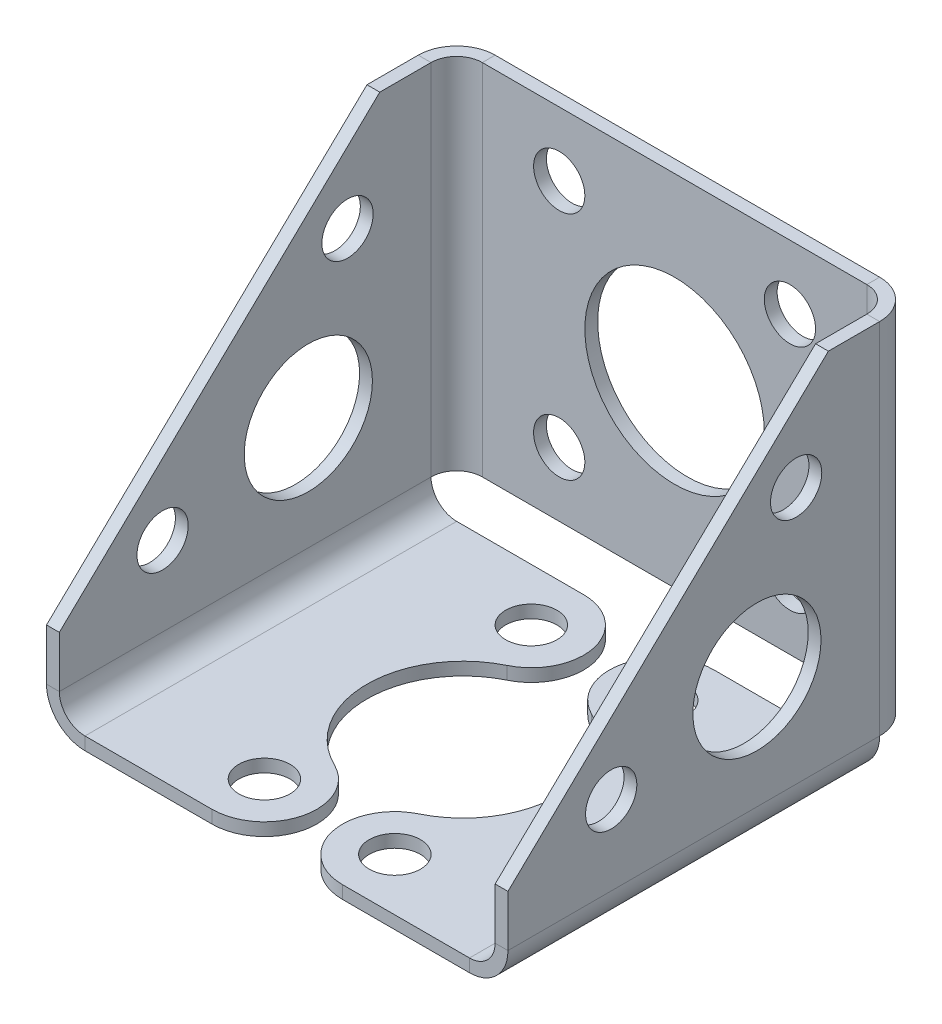
from build123d import *

# Parameters (mm, degrees)
SKETCH1_W                      = 180
SKETCH1_H                      = 140
BASE_FLANGE1_DEPTH             = 5
EDGE_FLANGE1_STRIP_W           = 40
EDGE_FLANGE1_STRIP_H           = 5
EDGE_FLANGE1_STRIP_CUT_DEPTH   = 140
EDGE_FLANGE1_STRIP_2_W         = 40
EDGE_FLANGE1_STRIP_2_H         = 5
EDGE_FLANGE1_STRIP_CUT_2_DEPTH = 140
EDGE_FLANGE1_DEPTH             = 140
EDGE_FLANGE1_BEND_DEPTH        = 140
EDGE_FLANGE2_DEPTH             = 145
EDGE_FLANGE2_BEND_DEPTH        = 145
CUT_EXTRUDE1_DEPTH             = 256.391855782
CUT_EXTRUDE3_DEPTH             = 10
UNFOLD2_START                  = -85
UNFOLD2_DEPTH                  = 155
UNFOLD2_START_2                = -127.134954085
UNFOLD2_2_OUTLINE_W            = 145
UNFOLD2_2_OUTLINE_H            = 5
UNFOLD2_2_DEPTH                = 77.134954085
UNFOLD2_START_3                = -70
UNFOLD2_3_DEPTH                = 140
UNFOLD2_4_DEPTH                = 5
SKETCH24_R                     = 10
SKETCH24_R_2                   = 25
SKETCH24_R_3                   = 35
CUT_EXTRUDE4_DEPTH             = 10
FOLD1_START                    = -161
FOLD1_DEPTH                    = 231
FOLD1_START_2                  = -85
FOLD1_2_OUTLINE_R              = 10
FOLD1_2_DEPTH                  = 15
FOLD1_START_3                  = -70
FOLD1_3_DEPTH                  = 140
FOLD1_START_4                  = -75
FOLD1_4_OUTLINE_W              = 10
FOLD1_4_OUTLINE_H              = 145
FOLD1_4_DEPTH                  = 150
FOLD1_START_5                  = -90
FOLD1_5_OUTLINE_R              = 25
FOLD1_5_OUTLINE_R_2            = 10
FOLD1_5_DEPTH                  = 180
FOLD1_6_OUTLINE_W              = 5
FOLD1_6_OUTLINE_H              = 145
FOLD1_6_DEPTH                  = 2.982774194
FOLD1_START_6                  = 87.176322581
FOLD1_7_OUTLINE_W              = 5
FOLD1_7_OUTLINE_H              = 145
FOLD1_7_DEPTH                  = 2.823677419
FOLD1_START_7                  = 15
FOLD1_8_DEPTH                  = 145


with BuildPart() as part:
    # Base-Flange1: sheet metal written as solids
    # Sketch1 → Base-Flange1 (new body)
    with BuildSketch(Plane.XY):
        Rectangle(SKETCH1_W, SKETCH1_H)
    extrude(amount=BASE_FLANGE1_DEPTH)

    # Edge-Flange1: sheet metal written as solids
    # Edge-Flange1 strip (on a plane across the edge) → Edge-Flange1 strip cut (cut)
    with BuildSketch(Plane(origin=(-90, 70, 5), x_dir=(1, 0, 0), z_dir=(0, -1, 0))):
        with Locations((-5, -2.5)):
            Rectangle(EDGE_FLANGE1_STRIP_W, EDGE_FLANGE1_STRIP_H)
    extrude(amount=EDGE_FLANGE1_STRIP_CUT_DEPTH, mode=Mode.SUBTRACT)

    # Edge-Flange1 strip 2 (on a plane across the edge) → Edge-Flange1 strip cut 2 (cut)
    with BuildSketch(Plane(origin=(90, -70, 5), x_dir=(-1, 0, 0), z_dir=(0, 1, 0))):
        with Locations((-5, -2.5)):
            Rectangle(EDGE_FLANGE1_STRIP_2_W, EDGE_FLANGE1_STRIP_2_H)
    extrude(amount=EDGE_FLANGE1_STRIP_CUT_2_DEPTH, mode=Mode.SUBTRACT)

    # Edge-Flange1 section (on a plane across the edge) → Edge-Flange1 (add)
    with BuildSketch(Plane(origin=(-90, 70, 5), x_dir=(1, 0, 0), z_dir=(0, -1, 0))):
        with BuildLine():
            Line((0, 10), (0, 155))
            Line((0, 155), (5, 155))
            Line((5, 155), (5, 10))
            ThreePointArc((5, 10), (7.928932188, 2.928932188), (15, 0))
            Line((15, 0), (15, -5))
            ThreePointArc((15, -5), (4.393398282, -0.606601718), (0, 10))
        make_face()
    extrude(amount=EDGE_FLANGE1_DEPTH)

    # Edge-Flange1 section 2 (on a plane across the edge) → Edge-Flange1 bend (add)
    with BuildSketch(Plane(origin=(90, -70, 5), x_dir=(-1, 0, 0), z_dir=(0, 1, 0))):
        with BuildLine():
            Line((0, 10), (0, 155))
            Line((0, 155), (5, 155))
            Line((5, 155), (5, 10))
            ThreePointArc((5, 10), (7.928932188, 2.928932188), (15, 0))
            Line((15, 0), (15, -5))
            ThreePointArc((15, -5), (4.393398282, -0.606601718), (0, 10))
        make_face()
    extrude(amount=EDGE_FLANGE1_BEND_DEPTH)

    # Edge-Flange2: sheet metal written as solids
    # Edge-Flange2 section (on a plane across the edge) → Edge-Flange2 (add)
    with BuildSketch(Plane(origin=(-85, -80, 160), x_dir=(0, 1, 0), z_dir=(0, 0, -1))):
        with BuildLine():
            Line((-5, 10), (-5, 80))
            Line((-5, 80), (0, 80))
            Line((0, 80), (0, 10))
            ThreePointArc((0, 10), (2.928932188, 2.928932188), (10, 0))
            Line((10, 0), (10, -5))
            ThreePointArc((10, -5), (-0.606601718, -0.606601718), (-5, 10))
        make_face()
    extrude(amount=EDGE_FLANGE2_DEPTH)

    # Edge-Flange2 section 2 (on a plane across the edge) → Edge-Flange2 bend (add)
    with BuildSketch(Plane(origin=(85, -80, 15), x_dir=(0, 1, 0), z_dir=(0, 0, 1))):
        with BuildLine():
            Line((-5, 10), (-5, 80))
            Line((-5, 80), (0, 80))
            Line((0, 80), (0, 10))
            ThreePointArc((0, 10), (2.928932188, 2.928932188), (10, 0))
            Line((10, 0), (10, -5))
            ThreePointArc((10, -5), (-0.606601718, -0.606601718), (-5, 10))
        make_face()
    extrude(amount=EDGE_FLANGE2_BEND_DEPTH)

    # Sketch18 → Cut-Extrude1 (cut, through all)
    with BuildSketch(Plane(origin=(90, 0, 0), x_dir=(0, 0, -1), z_dir=(1, 0, 0))):
        Polygon((-35, 70), (-160, 70), (-160, -50), align=None)
    extrude(amount=-CUT_EXTRUDE1_DEPTH, mode=Mode.SUBTRACT)

    # Sketch19 → Cut-Extrude3 (cut)
    with BuildSketch(Plane(origin=(0, -80, 0), x_dir=(1, 0, 0), z_dir=(0, 1, 0))):
        with BuildLine():
            ThreePointArc((-25.442327374, -15), (-10.987419064, -20.987419064), (-5, -35.442327374))
            Line((-5, -35.442327374), (-5, -15))
            Line((-5, -15), (-25.442327374, -15))
        make_face()
        with BuildLine():
            Line((25.442327374, -15), (5, -15))
            Line((5, -15), (5, -35.442327365))
            ThreePointArc((5, -35.442327365), (10.987419068, -20.987419061), (25.442327374, -15))
        make_face()
        with BuildLine():
            ThreePointArc((-16.466153842, -121.191479303), (-8.101874289, -128.731896198), (-5, -139.557672626))
            Line((-5, -139.557672626), (-5, -35.442327374))
            ThreePointArc((-5, -35.442327374), (-8.101874289, -46.268103802), (-16.466153842, -53.808520697))
            ThreePointArc((-16.466153842, -53.808520697), (-37.5, -87.5), (-16.466153842, -121.191479303))
        make_face()
        with BuildLine():
            ThreePointArc((16.466153842, -53.808520697), (8.101874287, -46.268103798), (5, -35.442327365))
            Line((5, -35.442327365), (5, -139.557672626))
            ThreePointArc((5, -139.557672626), (8.101874289, -128.731896198), (16.466153842, -121.191479303))
            ThreePointArc((16.466153842, -121.191479303), (37.5, -87.5), (16.466153842, -53.808520697))
        make_face()
        with BuildLine():
            Line((-25.442327374, -160), (-5, -160))
            Line((-5, -160), (-5, -139.557672626))
            ThreePointArc((-5, -139.557672626), (-10.987419064, -154.012580936), (-25.442327374, -160))
        make_face()
        with BuildLine():
            ThreePointArc((25.442327374, -160), (10.987419064, -154.012580936), (5, -139.557672626))
            Line((5, -139.557672626), (5, -160))
            Line((5, -160), (25.442327374, -160))
        make_face()
    extrude(amount=-CUT_EXTRUDE3_DEPTH, mode=Mode.SUBTRACT)

    # Unfold2: read off the stored shape, not the designer's step
    # Unfold2 outline → Unfold2 (cut)
    with BuildSketch(Plane(origin=(0, 0, 0), x_dir=(1, 0, 0), z_dir=(0, 1, 0)).offset(UNFOLD2_START)):
        with BuildLine():
            Line((86.180339888, -5), (75, -5))
            ThreePointArc((75, -5), (82.071067812, -7.928932188), (85, -15))
            Line((85, -15), (25.442327374, -15))
            ThreePointArc((25.442327374, -15), (5.525795485, -30.835755333), (16.466153842, -53.808520697))
            ThreePointArc((16.466153842, -53.808520697), (37.5, -87.5), (16.466153842, -121.191479303))
            ThreePointArc((16.466153842, -121.191479303), (5.525795485, -144.164244667), (25.442327374, -160))
            Line((25.442327374, -160), (90, -160))
            Line((90, -160), (90, -15))
            ThreePointArc((90, -15), (89.012585385, -9.647668653), (86.180339888, -5))
        make_face()
        with BuildLine():
            Line((-75, -5), (-86.180339888, -5))
            ThreePointArc((-86.180339888, -5), (-89.012585385, -9.647668653), (-90, -15))
            Line((-90, -15), (-90, -160))
            Line((-90, -160), (-25.442327374, -160))
            ThreePointArc((-25.442327374, -160), (-5.525795485, -144.164244667), (-16.466153842, -121.191479303))
            ThreePointArc((-16.466153842, -121.191479303), (-37.5, -87.5), (-16.466153842, -53.808520697))
            ThreePointArc((-16.466153842, -53.808520697), (-5.525795485, -30.835755333), (-25.442327374, -15))
            Line((-25.442327374, -15), (-85, -15))
            ThreePointArc((-85, -15), (-82.071067812, -7.928932188), (-75, -5))
        make_face()
    extrude(amount=UNFOLD2_DEPTH, mode=Mode.SUBTRACT)



with BuildPart() as body_2:
    # Unfold2 2 outline → Unfold2 2 (new body)
    with BuildSketch(Plane(origin=(0, 0, 0), x_dir=(1, 0, 0), z_dir=(0, 1, 0)).offset(UNFOLD2_START_2)):
        with Locations((167.134954085, -2.5)):
            Rectangle(UNFOLD2_2_OUTLINE_W, UNFOLD2_2_OUTLINE_H)
        with Locations((-167.134954085, -2.5)):
            Rectangle(UNFOLD2_2_OUTLINE_W, UNFOLD2_2_OUTLINE_H)
    extrude(amount=UNFOLD2_2_DEPTH)


with BuildPart() as part_1:
    add(part.part)

    add(body_2.part)  # Unfold2 3 merges body 2
    # Unfold2 3 outline → Unfold2 3 (add)
    with BuildSketch(Plane(origin=(0, 0, 0), x_dir=(1, 0, 0), z_dir=(0, 1, 0)).offset(UNFOLD2_START_3)):
        with BuildLine():
            ThreePointArc((75, 0), (81.123724357, -1.306936062), (86.180339888, -5))
            Line((86.180339888, -5), (94.634954085, -5))
            Line((94.634954085, -5), (94.634954085, 0))
            Line((94.634954085, 0), (75, 0))
        make_face()
        with BuildLine():
            Line((-94.634954085, 0), (-94.634954085, -5))
            Line((-94.634954085, -5), (-86.180339888, -5))
            ThreePointArc((-86.180339888, -5), (-81.123724357, -1.306936062), (-75, 0))
            Line((-75, 0), (-94.634954085, 0))
        make_face()
    extrude(amount=UNFOLD2_3_DEPTH)

    # Unfold2 4 outline → Unfold2 4 (add)
    with BuildSketch(Plane.XY):
        Polygon((114.634954085, 70), (94.634954085, 70), (94.634954085, -50), (239.634954085, -50), align=None)
        Polygon((-94.634954085, 70), (-114.634954085, 70), (-239.634954085, -50), (-94.634954085, -50), align=None)
        with BuildLine():
            ThreePointArc((133.443474782, -148.168800243), (147.275834791, -132.825122573), (167.134953866, -127.134954085))
            Line((167.134953866, -127.134954085), (94.634954085, -127.134954085))
            Line((94.634954085, -127.134954085), (94.634954085, -139.192626711))
            ThreePointArc((94.634954085, -139.192626711), (110.470709418, -159.1091586), (133.443474782, -148.168800243))
        make_face()
        with BuildLine():
            ThreePointArc((167.134953866, -127.134954085), (186.994073194, -132.825122457), (200.826433388, -148.168800243))
            ThreePointArc((200.826433388, -148.168800243), (223.799198752, -159.1091586), (239.634954085, -139.192626711))
            Line((239.634954085, -139.192626711), (239.634954085, -127.134954085))
            Line((239.634954085, -127.134954085), (167.134953866, -127.134954085))
        make_face()
        with BuildLine():
            ThreePointArc((-200.826433388, -148.168800243), (-186.994073379, -132.825122573), (-167.134954304, -127.134954085))
            Line((-167.134954304, -127.134954085), (-239.634954085, -127.134954085))
            Line((-239.634954085, -127.134954085), (-239.634954085, -139.192626711))
            ThreePointArc((-239.634954085, -139.192626711), (-223.799198752, -159.1091586), (-200.826433388, -148.168800243))
        make_face()
        with BuildLine():
            ThreePointArc((-167.134954304, -127.134954085), (-147.275834976, -132.825122457), (-133.443474782, -148.168800243))
            ThreePointArc((-133.443474782, -148.168800243), (-110.470709418, -159.1091586), (-94.634954085, -139.192626711))
            Line((-94.634954085, -139.192626711), (-94.634954085, -127.134954085))
            Line((-94.634954085, -127.134954085), (-167.134954304, -127.134954085))
        make_face()
    extrude(amount=UNFOLD2_4_DEPTH)

    # Sketch24 → Cut-Extrude4 (cut)
    with BuildSketch(Plane.XY.offset(5)):
        with Locations((-219.192626711, -139.192626711)):
            Circle(SKETCH24_R)
        with Locations((-115.077281458, -139.192626711)):
            Circle(SKETCH24_R)
        with Locations((115.077281458, -139.192626711)):
            Circle(SKETCH24_R)
        with Locations((-45, -45)):
            Circle(SKETCH24_R)
        with Locations((45, -45)):
            Circle(SKETCH24_R)
        with Locations((219.192626711, -139.192626711)):
            Circle(SKETCH24_R)
        with Locations((-45, 45)):
            Circle(SKETCH24_R)
        with Locations((45, 45)):
            Circle(SKETCH24_R)
        with Locations((-199.353683573, -39.05433783)):
            Circle(SKETCH24_R)
        with Locations((-127.21495147, 30.198844989)):
            Circle(SKETCH24_R)
        with Locations((-142.508362675, -26.069366052)):
            Circle(SKETCH24_R_2)
        Circle(SKETCH24_R_3)
        with Locations(Location((142.508362675, -26.069366052, 0), (0, 0, 180))):
            Circle(SKETCH24_R_2)
        with Locations(Location((199.353683573, -39.05433783, 0), (0, 0, 180))):
            Circle(SKETCH24_R)
        with Locations(Location((127.21495147, 30.198844989, 0), (0, 0, 180))):
            Circle(SKETCH24_R)
    extrude(amount=-CUT_EXTRUDE4_DEPTH, mode=Mode.SUBTRACT)

    # Fold1: read off the stored shape, not the designer's step
    # Fold1 outline → Fold1 (cut)
    with BuildSketch(Plane(origin=(0, 0, 0), x_dir=(1, 0, 0), z_dir=(0, 1, 0)).offset(FOLD1_START)):
        with BuildLine():
            ThreePointArc((75, 0), (81.123724357, -1.306936062), (86.180339888, -5))
            Line((86.180339888, -5), (239.634954085, -5))
            Line((239.634954085, -5), (239.634954085, 0))
            Line((239.634954085, 0), (75, 0))
        make_face()
        with BuildLine():
            ThreePointArc((-86.180339888, -5), (-81.123724357, -1.306936062), (-75, 0))
            Line((-75, 0), (-239.634954085, 0))
            Line((-239.634954085, 0), (-239.634954085, -5))
            Line((-239.634954085, -5), (-86.180339888, -5))
        make_face()
    extrude(amount=FOLD1_DEPTH, mode=Mode.SUBTRACT)



with BuildPart() as body_2_2:
    # Fold1 2 outline → Fold1 2 (new body)
    # profile 1 of 2: a face of its own
    with BuildSketch(Plane(origin=(0, 0, 0), x_dir=(1, 0, 0), z_dir=(0, 1, 0)).offset(FOLD1_START_2)):
        with BuildLine():
            Line((90, -160), (90, -15))
            Line((90, -15), (25.442327374, -15))
            ThreePointArc((25.442327374, -15), (5.525795485, -30.835755333), (16.466153842, -53.808520697))
            ThreePointArc((16.466153842, -53.808520697), (37.5, -87.5), (16.466153842, -121.191479303))
            ThreePointArc((16.466153842, -121.191479303), (5.525795485, -144.164244667), (25.442327374, -160))
            Line((25.442327374, -160), (90, -160))
        make_face()
        with Locations((25.442327374, -139.557672626)):
            Circle(FOLD1_2_OUTLINE_R, mode=Mode.SUBTRACT)
        with Locations((25.442327374, -35.442327374)):
            Circle(FOLD1_2_OUTLINE_R, mode=Mode.SUBTRACT)
    # profile 2 of 2: a face of its own
    with BuildSketch(Plane(origin=(0, 0, 0), x_dir=(1, 0, 0), z_dir=(0, 1, 0)).offset(FOLD1_START_2)):
        with BuildLine():
            ThreePointArc((-16.466153842, -121.191479303), (-37.5, -87.5), (-16.466153842, -53.808520697))
            ThreePointArc((-16.466153842, -53.808520697), (-5.525795485, -30.835755333), (-25.442327374, -15))
            Line((-25.442327374, -15), (-90, -15))
            Line((-90, -15), (-90, -160))
            Line((-90, -160), (-25.442327374, -160))
            ThreePointArc((-25.442327374, -160), (-5.525795485, -144.164244667), (-16.466153842, -121.191479303))
        make_face()
        with Locations((-25.442327374, -139.557672626)):
            Circle(FOLD1_2_OUTLINE_R, mode=Mode.SUBTRACT)
        with Locations((-25.442327374, -35.442327374)):
            Circle(FOLD1_2_OUTLINE_R, mode=Mode.SUBTRACT)
    extrude(amount=FOLD1_2_DEPTH)


with BuildPart() as part_2:
    add(part_1.part)

    add(body_2_2.part)  # Fold1 3 merges body 2 2
    # Fold1 3 outline → Fold1 3 (add)
    with BuildSketch(Plane(origin=(0, 0, 0), x_dir=(1, 0, 0), z_dir=(0, 1, 0)).offset(FOLD1_START_3)):
        with BuildLine():
            ThreePointArc((75, -5), (82.071067812, -7.928932188), (85, -15))
            Line((85, -15), (85, -160))
            Line((85, -160), (90, -160))
            Line((90, -160), (90, -15))
            ThreePointArc((90, -15), (89.012585385, -9.647668653), (86.180339888, -5))
            Line((86.180339888, -5), (75, -5))
        make_face()
        with BuildLine():
            Line((-85, -160), (-85, -15))
            ThreePointArc((-85, -15), (-82.071067812, -7.928932188), (-75, -5))
            Line((-75, -5), (-86.180339888, -5))
            ThreePointArc((-86.180339888, -5), (-89.012585385, -9.647668653), (-90, -15))
            Line((-90, -15), (-90, -160))
            Line((-90, -160), (-85, -160))
        make_face()
    extrude(amount=FOLD1_3_DEPTH)

    # Fold1 4 outline → Fold1 4 (cut)
    with BuildSketch(Plane.YZ.offset(FOLD1_START_4)):
        with Locations((-75, 87.5)):
            Rectangle(FOLD1_4_OUTLINE_W, FOLD1_4_OUTLINE_H)
    extrude(amount=FOLD1_4_DEPTH, mode=Mode.SUBTRACT)

    # Fold1 5 outline → Fold1 5 (cut)
    with BuildSketch(Plane.YZ.offset(FOLD1_START_5)):
        Polygon((70, 160), (-50, 160), (70, 35), align=None)
        with Locations((-26.069366052, 62.873408591)):
            Circle(FOLD1_5_OUTLINE_R)
        with Locations((-39.05433783, 119.718729488)):
            Circle(FOLD1_5_OUTLINE_R_2)
        with Locations((30.198844989, 47.579997385)):
            Circle(FOLD1_5_OUTLINE_R_2)
    extrude(amount=FOLD1_5_DEPTH, mode=Mode.SUBTRACT)

    # Fold1 6 outline → Fold1 6 (cut)
    with BuildSketch(Plane.YZ.offset(FOLD1_START_5)):
        with Locations((-82.5, 87.5)):
            Rectangle(FOLD1_6_OUTLINE_W, FOLD1_6_OUTLINE_H)
    extrude(amount=FOLD1_6_DEPTH, mode=Mode.SUBTRACT)

    # Fold1 7 outline → Fold1 7 (cut)
    with BuildSketch(Plane.YZ.offset(FOLD1_START_6)):
        with Locations((-82.5, 87.5)):
            Rectangle(FOLD1_7_OUTLINE_W, FOLD1_7_OUTLINE_H)
    extrude(amount=FOLD1_7_DEPTH, mode=Mode.SUBTRACT)

    # Fold1 8 outline → Fold1 8 (cut)
    with BuildSketch(Plane.XY.offset(FOLD1_START_7)):
        with BuildLine():
            ThreePointArc((90, -70), (85.606601718, -80.606601718), (75, -85))
            Line((75, -85), (87.176322581, -85))
            Line((87.176322581, -85), (87.176322581, -80))
            Line((87.176322581, -80), (90, -80))
            Line((90, -80), (90, -70))
        make_face()
        with BuildLine():
            Line((75, -70), (75, -80))
            ThreePointArc((75, -80), (82.071067812, -77.071067812), (85, -70))
            Line((85, -70), (75, -70))
        make_face()
        with BuildLine():
            Line((-87.017225806, -85), (-75, -85))
            ThreePointArc((-75, -85), (-85.606601718, -80.606601718), (-90, -70))
            Line((-90, -70), (-90, -80))
            Line((-90, -80), (-87.017225806, -80))
            Line((-87.017225806, -80), (-87.017225806, -85))
        make_face()
        with BuildLine():
            ThreePointArc((-85, -70), (-82.071067812, -77.071067812), (-75, -80))
            Line((-75, -80), (-75, -70))
            Line((-75, -70), (-85, -70))
        make_face()
    extrude(amount=FOLD1_8_DEPTH, mode=Mode.SUBTRACT)


solid = part_2.part
